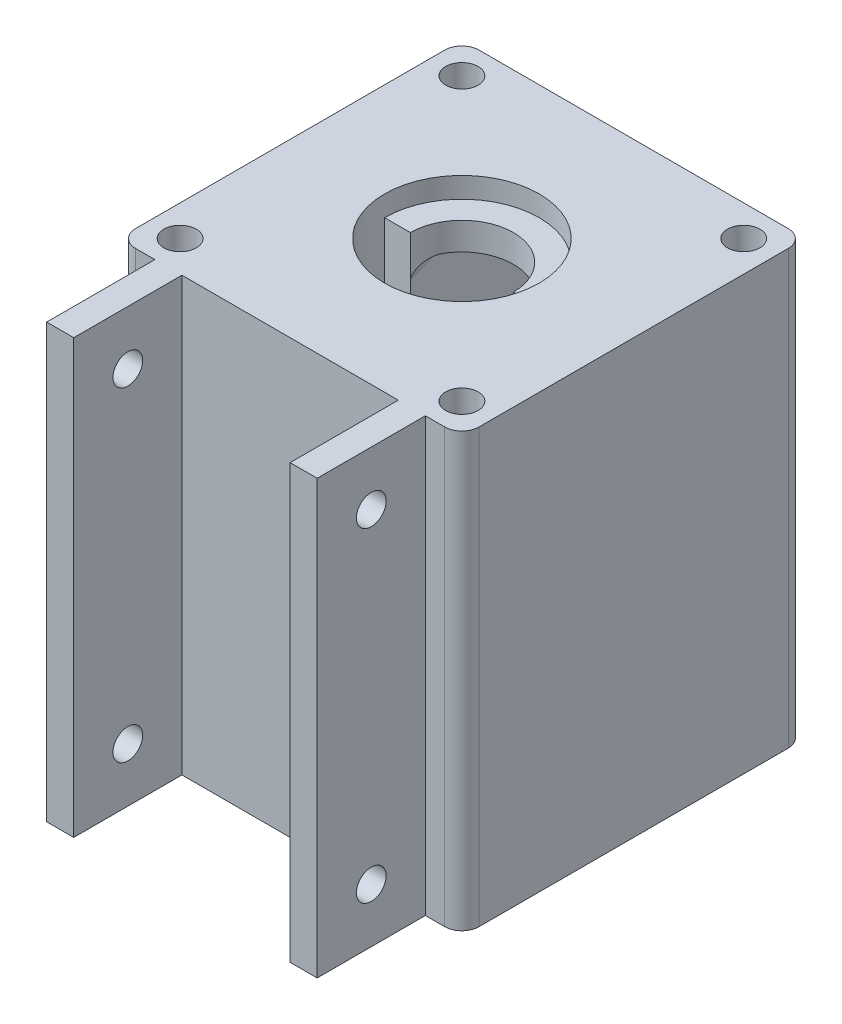
from build123d import *
from build123d.topology import SkipClean

# Parameters (mm, degrees)
BOSS_EXTRUDE1_DEPTH            = 80
CUT_EXTRUDE1_REACH             = 93.739
FILLET1_R                      = 3.175
SKETCH4_R                      = 14.287500000000003
CUT_EXTRUDE2_DEPTH             = 3.8099999999999996
CUT_EXTRUDE3_DEPTH             = 62.22
CUT_EXTRUDE4_REACH             = 93.739
CUT_EXTRUDE4_DIRECTION_2_REACH = 93.739
FILLET2_R                      = 2.54
BOSS_EXTRUDE2_DEPTH            = 20
SKETCH10_R                     = 2.750000000000002
SKETCH10_R_2                   = 2.7500000000000018
CUT_EXTRUDE6_DEPTH             = 111.89916591210233
SKETCH11_R                     = 2.9999999999999973
SKETCH11_R_2                   = 3.0000000000000004
CUT_EXTRUDE7_DEPTH             = 10
CUT_EXTRUDE8_START             = -10
SKETCH12_R                     = 2.9999999999999973
SKETCH12_R_2                   = 3.0000000000000018
CUT_EXTRUDE8_DEPTH             = 10
SKETCH8_R                      = 3.0000000000000018
SKETCH8_R_2                    = 3.0000000000000013
CUT_EXTRUDE9_DEPTH             = 10


with BuildPart() as part:
    # Sketch2 → Boss-Extrude1 (new body)
    with BuildSketch(Plane(origin=(0, 0, 0), x_dir=(1, 0, 0), z_dir=(0, 1, 0))):
        Polygon((-31.75, 31.75), (31.749999999999993, 31.75), (31.750000000000007, -31.750000000000007), (-31.749999999999993, -31.750000000000007), align=None)
    extrude(amount=BOSS_EXTRUDE1_DEPTH)

    # Sketch3 → Cut-Extrude1 (cut, up to next)
    with BuildSketch(Plane(origin=(0, 80, 0), x_dir=(1, 0, 0), z_dir=(0, 1, 0)), mode=Mode.PRIVATE) as cut_extrude1_sk1:
        with BuildLine():
            Line((9.525, 0), (14.287500000000001, 0))
            ThreePointArc((14.287500000000001, 0), (-2.62e-15, -14.287500000000001), (-14.287500000000001, 0))
            Line((-14.287500000000001, 0), (-9.525, 0))
            ThreePointArc((-9.525, 0), (5.8e-16, 9.525), (9.525, 0))
        make_face()
    cut_extrude1_tool1 = extrude(cut_extrude1_sk1.sketch, amount=-CUT_EXTRUDE1_REACH, mode=Mode.PRIVATE) & part.part
    add(cut_extrude1_tool1.solids().sort_by_distance((0, 80, 2.954161))[0], mode=Mode.SUBTRACT)

    # Fillet1
    fillet1_edges = [part.edges().sort_by_distance(p)[0] for p in [
        (31.750000000000007, 40, 31.750000000000007),
        (-31.749999999999993, 40, 31.750000000000007),
        (-31.75, 40, -31.75),
        (31.749999999999993, 40, -31.75),
    ]]
    fillet(fillet1_edges, radius=FILLET1_R)

    # Sketch4 → Cut-Extrude2 (cut)
    with BuildSketch(Plane(origin=(0, 80, 0), x_dir=(1, 0, 0), z_dir=(0, 1, 0))):
        with Locations(Location((0, 0, 0), (0, 0, 270))):
            Circle(SKETCH4_R)
    extrude(amount=-CUT_EXTRUDE2_DEPTH, mode=Mode.SUBTRACT)

    # Sketch6 → Cut-Extrude3 (cut)
    with BuildSketch(Plane(origin=(0, 71.11000000000001, 0), x_dir=(1, 0, 0), z_dir=(0, 1, 0))):
        with BuildLine():
            Line((9.525, 0), (19.050000000000008, 31.750000000000007))
            Line((19.050000000000008, 31.750000000000007), (-19.050000000000008, 31.750000000000007))
            Line((-19.050000000000008, 31.750000000000007), (-9.525, 0))
            ThreePointArc((-9.525, 0), (5.8e-16, 9.525), (9.525, 0))
        make_face()
    extrude(amount=-CUT_EXTRUDE3_DEPTH, mode=Mode.SUBTRACT)

    # Cut-Extrude4: up to this plane
    with SkipClean():  # the faces are left unmerged after this step: merging them gives an invalid solid
        cut_extrude4_end = Plane(origin=(-9.525, -49.595085442007274, 0), z_dir=(-0.9578262852211514, 0, 0.2873478855663456))
        # Sketch7 → Cut-Extrude4 (cut, up to the surface)
        with BuildSketch(Plane(origin=(0, 0, 0), x_dir=(0, 0, -1), z_dir=(1, 0, 0)), mode=Mode.PRIVATE) as cut_extrude4_sk1:
            Polygon((0, 8.889999999999995), (31.750000000000007, 8.889999999999995), (0, 0), align=None)
        cut_extrude4_tool1 = split(extrude(cut_extrude4_sk1.sketch, amount=-CUT_EXTRUDE4_REACH, mode=Mode.PRIVATE), bisect_by=cut_extrude4_end, keep=Keep.BOTH, mode=Mode.PRIVATE)
        add(cut_extrude4_tool1.solids().sort_by_distance((0, 5.926667, -10.583333))[0], mode=Mode.SUBTRACT)

    # Cut-Extrude4 direction 2: up to this plane
    cut_extrude4_direction_2_end = Plane(origin=(9.525, -49.595085442007274, 0), z_dir=(0.9578262852211514, 0, 0.2873478855663456))
    # Sketch7 → Cut-Extrude4 direction 2 (cut, up to the surface)
    with BuildSketch(Plane(origin=(0, 0, 0), x_dir=(0, 0, -1), z_dir=(1, 0, 0)), mode=Mode.PRIVATE) as cut_extrude4_direction_2_sk1:
        Polygon((0, 8.889999999999995), (31.750000000000007, 8.889999999999995), (0, 0), align=None)
    cut_extrude4_direction_2_tool1 = split(extrude(cut_extrude4_direction_2_sk1.sketch, amount=CUT_EXTRUDE4_DIRECTION_2_REACH, mode=Mode.PRIVATE), bisect_by=cut_extrude4_direction_2_end, keep=Keep.BOTH, mode=Mode.PRIVATE)
    add(cut_extrude4_direction_2_tool1.solids().sort_by_distance((0, 5.926667, -10.583333))[0], mode=Mode.SUBTRACT)

    # Fillet2
    # the kernel refuses this fillet: 2.54 mm, written as the material it adds along each edge
    with BuildSketch(Plane(origin=(7.700340926653701, 71.11000000000001, 6.082196911154327), x_dir=(-0.9578262852211514, 0, -0.28734788556634555), z_dir=(0.28734788556634555, 0, -0.9578262852211513))) as fillet2_piece_1_section:
        with BuildLine():
            CenterArc((FILLET2_R, -FILLET2_R), FILLET2_R, 90, 90)
            Line((-5.1e-16, -FILLET2_R), (0, 0))
            Line((0, 0), (FILLET2_R, 0))
        make_face()
    fillet2_piece_1 = extrude(amount=45.84797316579104, mode=Mode.PRIVATE)
    fillet2_piece_1 = split(fillet2_piece_1, bisect_by=Plane(origin=(13.914299200637444, 70.52222392157218, -31.75), z_dir=(0, 0, 1)), keep=Keep.TOP, mode=Mode.PRIVATE)
    fillet2_piece_1 = fillet2_piece_1 - Plane(origin=(0, 70.52222392157218, 8.9e-16), x_dir=(-1, 0, -9e-17), z_dir=(0, 1, 0)) * Cylinder(9.525, 102, mode=Mode.PRIVATE)
    fillet2_piece_1 = split(fillet2_piece_1, bisect_by=Plane(origin=(13.914299200637442, 70.52222392157218, 0), z_dir=(0, 0, -1)), keep=Keep.TOP, mode=Mode.PRIVATE)
    add(fillet2_piece_1)
    with BuildSketch(Plane(origin=(-20.874659073346308, 71.11000000000001, -37.832196911154334), x_dir=(0, -1, 0), z_dir=(0.28734788556634555, 0, 0.9578262852211513))) as fillet2_piece_2_section:
        with BuildLine():
            CenterArc((FILLET2_R, FILLET2_R), FILLET2_R, 180.00000000000006, 89.99999999999994)
            Line((0, FILLET2_R), (0, 0))
            Line((0, 0), (FILLET2_R, 0))
        make_face()
    fillet2_piece_2 = extrude(amount=45.84797316579104, mode=Mode.PRIVATE)
    fillet2_piece_2 = split(fillet2_piece_2, bisect_by=Plane(origin=(-13.914332155941864, 70.52223189515664, -31.75), z_dir=(0, 0, 1)), keep=Keep.TOP, mode=Mode.PRIVATE)
    fillet2_piece_2 = split(fillet2_piece_2, bisect_by=Plane(origin=(-13.914332155941862, 70.52223189515664, 0), z_dir=(0, 0, -1)), keep=Keep.TOP, mode=Mode.PRIVATE)
    fillet2_piece_2 = fillet2_piece_2 - Plane(origin=(0, 70.52223189515664, 8.9e-16), x_dir=(-1, 0, -9e-17), z_dir=(0, 1, 0)) * Cylinder(9.525, 102, mode=Mode.PRIVATE)
    add(fillet2_piece_2)
    with BuildSketch(Plane(origin=(-20.954648618716565, 10.667672044135445, -38.09882872905519), x_dir=(0.960714101631492, 0.07483307171461931, -0.2672609704093544), z_dir=(0.2775399339309484, -0.2590372716688848, 0.9251331131031606))) as fillet2_piece_3_section:
        with BuildLine():
            CenterArc((FILLET2_R * 1.08072615035, FILLET2_R), FILLET2_R, 175.556407911294, 94.443592088706)
            Line((FILLET2_R * 0.0837320564804, FILLET2_R * 1.07747758898), (0, 0))
            Line((0, 0), (FILLET2_R * 1.08072615035, -1e-17))
        make_face()
    fillet2_piece_3 = extrude(amount=48.04460766626356, mode=Mode.PRIVATE)
    fillet2_piece_3 = split(fillet2_piece_3, bisect_by=Plane(origin=(-13.878563212714184, 5.314679557030891, -31.75), z_dir=(0, 0, 1)), keep=Keep.TOP, mode=Mode.PRIVATE)
    fillet2_piece_3 = fillet2_piece_3 - Plane(origin=(0, 5.314679557030885, 8.9e-16), x_dir=(-1, 0, -9e-17), z_dir=(0, 1, 0)) * Cylinder(9.525, 108, mode=Mode.PRIVATE)
    fillet2_piece_3 = split(fillet2_piece_3, bisect_by=Plane(origin=(-13.878563212714182, 5.314679557030885, 0), z_dir=(0, 0, -1)), keep=Keep.TOP, mode=Mode.PRIVATE)
    add(fillet2_piece_3)
    with BuildSketch(Plane(origin=(20.954648618716565, 10.667672044135447, -38.0988287290552), x_dir=(-0.9607141016314922, 0.07483307171461993, -0.2672609704093543), z_dir=(-0.2775399339309484, -0.2590372716688848, 0.9251331131031606))) as fillet2_piece_4_section:
        with BuildLine():
            CenterArc((FILLET2_R * 1.08072615035, -FILLET2_R), FILLET2_R, 90.00000000000003, 94.443592088706)
            Line((FILLET2_R * 0.0837320564804, -FILLET2_R * 1.07747758898), (0, 0))
            Line((0, 0), (FILLET2_R * 1.08072615035, 4e-17))
        make_face()
    fillet2_piece_4 = extrude(amount=48.04460766626356, mode=Mode.PRIVATE)
    fillet2_piece_4 = split(fillet2_piece_4, bisect_by=Plane(origin=(13.878545723436886, 5.3146693763951145, -31.75), z_dir=(0, 0, 1)), keep=Keep.TOP, mode=Mode.PRIVATE)
    fillet2_piece_4 = fillet2_piece_4 - Plane(origin=(0, 5.314669376395116, 8.9e-16), x_dir=(-1, 0, -9e-17), z_dir=(0, 1, 0)) * Cylinder(9.525, 108, mode=Mode.PRIVATE)
    fillet2_piece_4 = split(fillet2_piece_4, bisect_by=Plane(origin=(13.878545723436885, 5.314669376395116, 0), z_dir=(0, 0, -1)), keep=Keep.TOP, mode=Mode.PRIVATE)
    add(fillet2_piece_4)

    # Sketch9 → Boss-Extrude2 (add)
    with BuildSketch(Plane.XY.offset(31.750000000000007)):
        Polygon((-20, 80), (-25, 80), (-24.99999999999999, 0), (-19.99999999999999, -3.5e-16), align=None)
        Polygon((25.000000000000007, 80), (24.99999999999999, 0), (19.99999999999999, -3.5e-16), (20.000000000000007, 80), align=None)
    extrude(amount=BOSS_EXTRUDE2_DEPTH)

    # Sketch10 → Cut-Extrude6 (cut, through all)
    with BuildSketch(Plane.ZY.offset(24.99999999999999)):
        with Locations(Location((41.75000000000001, 70.00000000000001, 0), (0, 0, 270))):
            Circle(SKETCH10_R)
        with Locations(Location((41.750000000000014, 9.999999999999998, 0), (0, 0, 270))):
            Circle(SKETCH10_R_2)
    extrude(amount=-CUT_EXTRUDE6_DEPTH, mode=Mode.SUBTRACT)

    # Sketch11 → Cut-Extrude7 (cut)
    with BuildSketch(Plane.XZ):
        with Locations(Location((26.04274275110054, -26.04274275110054, 0), (0, 0, 270))):
            Circle(SKETCH11_R)
        with Locations(Location((26.042742751100416, 26.042742751100665, 0), (0, 0, 270))):
            Circle(SKETCH11_R)
        with Locations(Location((-26.04274275110067, -26.04274275110066, 0), (0, 0, 270))):
            Circle(SKETCH11_R_2)
        with Locations(Location((-26.042742751100786, 26.042742751100544, 0), (0, 0, 270))):
            Circle(SKETCH11_R_2)
    extrude(amount=-CUT_EXTRUDE7_DEPTH, mode=Mode.SUBTRACT)

    # Sketch12 → Cut-Extrude8 (cut)
    with BuildSketch(Plane(origin=(0, 80, 0), x_dir=(1, 0, 0), z_dir=(0, 1, 0)).offset(CUT_EXTRUDE8_START)):
        with Locations(Location((26.042742751100416, -26.042742751100665, 0), (0, 0, 90))):
            Circle(SKETCH12_R)
        with Locations(Location((26.04274275110054, 26.04274275110054, 0), (0, 0, 90))):
            Circle(SKETCH12_R)
        with Locations(Location((-26.04274275110067, 26.04274275110066, 0), (0, 0, 90))):
            Circle(SKETCH12_R_2)
        with Locations(Location((-26.042742751100786, -26.042742751100544, 0), (0, 0, 90))):
            Circle(SKETCH12_R_2)
    extrude(amount=CUT_EXTRUDE8_DEPTH, mode=Mode.SUBTRACT)

    # Sketch8 → Cut-Extrude9 (cut)
    with BuildSketch(Plane(origin=(0, 0, -31.75), x_dir=(-1, 0, 0), z_dir=(0, 0, -1))):
        with Locations((-23.574999999999985, 64.99999999999999)):
            Circle(SKETCH8_R)
        with Locations(Location((23.574999999999992, 64.99999999999999, 0), (0, 0, 180))):
            Circle(SKETCH8_R)
        with Locations((23.575, 15.000000000000014)):
            Circle(SKETCH8_R)
        with Locations(Location((-23.574999999999985, 15.000000000000009, 0), (0, 0, 180))):
            Circle(SKETCH8_R_2)
    extrude(amount=-CUT_EXTRUDE9_DEPTH, mode=Mode.SUBTRACT)


solid = part.part
